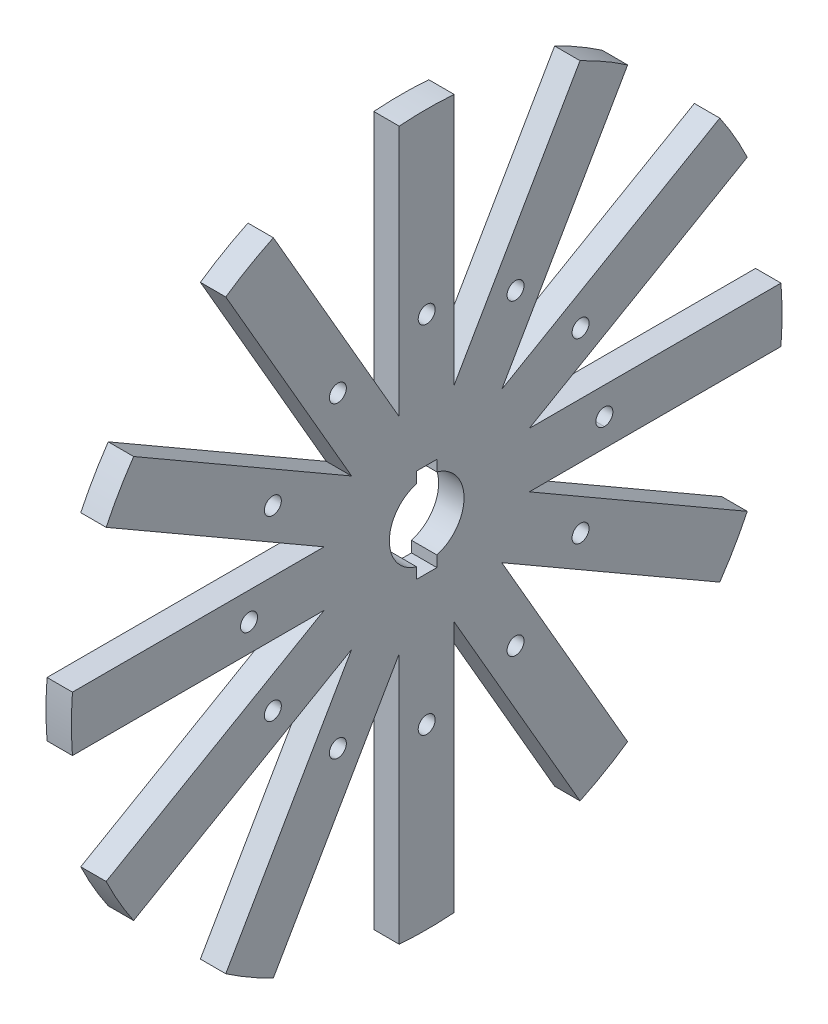
from build123d import *

# Parameters (mm, degrees)
SKETCH1_W           = 450
SKETCH1_H           = 450
BOSS_EXTRUDE1_DEPTH = 5
BOSS_EXTRUDE2_DEPTH = 7.48
BOSS_EXTRUDE3_DEPTH = 7.48
SKETCH6_W           = 450
SKETCH6_H           = 450
CUT_EXTRUDE1_DEPTH  = 5
SKETCH7_R           = 11
SKETCH7_R_2         = 2.5
CUT_EXTRUDE2_DEPTH  = 10
SKETCH8_R           = 209.3091
SKETCH8_R_2         = 104.5891
CUT_EXTRUDE3_DEPTH  = 10
BOSS_EXTRUDE4_DEPTH = 7.48
SKETCH11_R          = 2.5
CUT_EXTRUDE5_DEPTH  = 10


# Read off the part's stored shape, not the designer's step: Boss-Extrude2
with BuildPart() as part:
    # Sketch1 → Boss-Extrude1 (new body)
    with BuildSketch(Plane(origin=(0, 0, 0), x_dir=(0, 0, -1), z_dir=(1, 0, 0))):
        Rectangle(SKETCH1_W, SKETCH1_H)
    extrude(amount=BOSS_EXTRUDE1_DEPTH)

    # Boss-Extrude2 outline → Boss-Extrude2 (add)
    with BuildSketch(Plane(origin=(5, 0, 0), x_dir=(0, 0, -1), z_dir=(1, 0, 0))):
        with BuildLine():
            Line((-164.971757583, 8.09), (-209.152698388, 8.09))
            ThreePointArc((-209.152698388, 8.09), (-209.3091, 0), (-209.152698388, -8.09))
            Line((-209.152698388, -8.09), (-164.971757583, -8.09))
            ThreePointArc((-164.971757583, -8.09), (-116.792827049, -116.792827049), (-8.09, -164.971757583))
            Line((-8.09, -164.971757583), (-8.09, -209.152698388))
            ThreePointArc((-8.09, -209.152698388), (0, -209.3091), (8.09, -209.152698388))
            Line((8.09, -209.152698388), (8.09, -164.971757583))
            ThreePointArc((8.09, -164.971757583), (116.792827049, -116.792827049), (164.971757583, -8.09))
            Line((164.971757583, -8.09), (209.152698388, -8.09))
            ThreePointArc((209.152698388, -8.09), (209.3091, 0), (209.152698388, 8.09))
            Line((209.152698388, 8.09), (164.971757583, 8.09))
            ThreePointArc((164.971757583, 8.09), (116.792827049, 116.792827049), (8.09, 164.971757583))
            Line((8.09, 164.971757583), (8.09, 209.152698388))
            ThreePointArc((8.09, 209.152698388), (0, 209.3091), (-8.09, 209.152698388))
            Line((-8.09, 209.152698388), (-8.09, 164.971757583))
            ThreePointArc((-8.09, 164.971757583), (-116.792827049, 116.792827049), (-164.971757583, 8.09))
        make_face()
        with BuildLine():
            Line((148.770198629, 8.09), (104.538333308, 8.09))
            ThreePointArc((104.538333308, 8.09), (104.8509, 0), (104.538333308, -8.09))
            Line((104.538333308, -8.09), (148.770198629, -8.09))
            ThreePointArc((148.770198629, -8.09), (105.351839329, -105.351839329), (8.09, -148.770198629))
            Line((8.09, -148.770198629), (8.09, -104.538333308))
            ThreePointArc((8.09, -104.538333308), (0, -104.8509), (-8.09, -104.538333308))
            Line((-8.09, -104.538333308), (-8.09, -148.770198629))
            ThreePointArc((-8.09, -148.770198629), (-105.351839329, -105.351839329), (-148.770198629, -8.09))
            Line((-148.770198629, -8.09), (-104.538333308, -8.09))
            ThreePointArc((-104.538333308, -8.09), (-104.8509, 0), (-104.538333308, 8.09))
            Line((-104.538333308, 8.09), (-148.770198629, 8.09))
            ThreePointArc((-148.770198629, 8.09), (-105.351839329, 105.351839329), (-8.09, 148.770198629))
            Line((-8.09, 148.770198629), (-8.09, 104.538333308))
            ThreePointArc((-8.09, 104.538333308), (0, 104.8509), (8.09, 104.538333308))
            Line((8.09, 104.538333308), (8.09, 148.770198629))
            ThreePointArc((8.09, 148.770198629), (105.351839329, 105.351839329), (148.770198629, 8.09))
        make_face(mode=Mode.SUBTRACT)
    extrude(amount=BOSS_EXTRUDE2_DEPTH)

    # Sketch5 → Boss-Extrude3 (add)
    with BuildSketch(Plane(origin=(5, 0, 0), x_dir=(0, 0, -1), z_dir=(1, 0, 0))):
        with BuildLine():
            Line((-19.319547743, 8.09), (-104.275748565, 8.09))
            ThreePointArc((-104.275748565, 8.09), (-104.5891, 0), (-104.275748565, -8.09))
            Line((-104.275748565, -8.09), (-19.319547743, -8.09))
            ThreePointArc((-19.319547743, -8.09), (0, -20.945), (19.319547743, -8.09))
            Line((19.319547743, -8.09), (104.275748565, -8.09))
            ThreePointArc((104.275748565, -8.09), (104.5891, 0), (104.275748565, 8.09))
            Line((104.275748565, 8.09), (19.319547743, 8.09))
            ThreePointArc((19.319547743, 8.09), (0, 20.945), (-19.319547743, 8.09))
        make_face()
    extrude(amount=BOSS_EXTRUDE3_DEPTH)

    # Sketch6 → Cut-Extrude1 (cut)
    with BuildSketch(Plane.ZY):
        Rectangle(SKETCH6_W, SKETCH6_H)
    extrude(amount=-CUT_EXTRUDE1_DEPTH, mode=Mode.SUBTRACT)


with BuildPart() as cut_extrude1_piece_1:
    # of the separate pieces the step leaves, piece 1, a body of its own (cut_extrude1_pieces)
    add(part.part.solids().sort_by_distance((5, 209.152698388, 8.09))[0])


with BuildPart() as cut_extrude1_piece_2:
    # of the separate pieces the step leaves, piece 2, a body of its own (cut_extrude1_pieces)
    add(part.part.solids().sort_by_distance((5, 8.09, -104.275748565))[0])


with BuildPart() as cut_extrude2_tool:
    # Sketch7 → Cut-Extrude2 (new body)
    with BuildSketch(Plane(origin=(12.48, 0, 0), x_dir=(0, 0, -1), z_dir=(1, 0, 0))):
        Circle(SKETCH7_R)
        with Locations((-183.1891, 0)):
            Circle(SKETCH7_R_2)
        with Locations((-130.9659, 0)):
            Circle(SKETCH7_R_2)
        with Locations((0, -183.1891)):
            Circle(SKETCH7_R_2)
        with Locations((0, -130.9659)):
            Circle(SKETCH7_R_2)
        with Locations((183.1891, 0)):
            Circle(SKETCH7_R_2)
        with Locations((52.3, 0)):
            Circle(SKETCH7_R_2)
        with Locations((-52.295, 0)):
            Circle(SKETCH7_R_2)
        with Locations((0, 183.1891)):
            Circle(SKETCH7_R_2)
        with Locations((0, 130.9659)):
            Circle(SKETCH7_R_2)
        with BuildLine():
            Line((-3, 13.8), (-3, 10.583005244))
            ThreePointArc((-3, 10.583005244), (0, 11), (3, 10.583005244))
            Line((3, 10.583005244), (3, 13.8))
            Line((3, 13.8), (-3, 13.8))
        make_face()
        with BuildLine():
            ThreePointArc((3, -10.583005244), (0, -11), (-3, -10.583005244))
            Line((-3, -10.583005244), (-3, -13.8))
            Line((-3, -13.8), (3, -13.8))
            Line((3, -13.8), (3, -10.583005244))
        make_face()
        with Locations((130.9659, 0)):
            Circle(SKETCH7_R_2)
    extrude(amount=-CUT_EXTRUDE2_DEPTH)


with BuildPart() as cut_extrude1_piece_1_1:
    add(cut_extrude1_piece_1.part)

    # Cut-Extrude2: cut by cut_extrude2_tool
    add(cut_extrude2_tool.part, mode=Mode.SUBTRACT)

    # Sketch8 → Cut-Extrude3 (cut)
    with BuildSketch(Plane(origin=(12.48, 0, 0), x_dir=(0, 0, -1), z_dir=(1, 0, 0))):
        Circle(SKETCH8_R)
        Circle(SKETCH8_R_2, mode=Mode.SUBTRACT)
    extrude(amount=-CUT_EXTRUDE3_DEPTH, mode=Mode.SUBTRACT)


with BuildPart() as cut_extrude1_piece_2_1:
    add(cut_extrude1_piece_2.part)

    # Cut-Extrude2: cut by cut_extrude2_tool
    add(cut_extrude2_tool.part, mode=Mode.SUBTRACT)

    # Sketch9 → Boss-Extrude4 (add)
    with BuildSketch(Plane(origin=(12.48, 0, 0), x_dir=(0, 0, -1), z_dir=(1, 0, 0))):
        with BuildLine():
            Line((-94.350447256, 45.131728766), (-30.192291033, 8.09))
            Line((-30.192291033, 8.09), (-19.319547743, 8.09))
            ThreePointArc((-19.319547743, 8.09), (0, 20.945), (19.319547743, 8.09))
            Line((19.319547743, 8.09), (30.192291033, 8.09))
            Line((30.192291033, 8.09), (94.350447256, 45.131728766))
            ThreePointArc((94.350447256, 45.131728766), (90.576817559, 52.29455), (86.260447256, 59.144019799))
            Line((86.260447256, 59.144019799), (22.102291033, 22.102291033))
            Line((22.102291033, 22.102291033), (59.144019799, 86.260447256))
            ThreePointArc((59.144019799, 86.260447256), (52.29455, 90.576817559), (45.131728766, 94.350447256))
            Line((45.131728766, 94.350447256), (8.09, 30.192291033))
            Line((8.09, 30.192291033), (8.09, 104.275748565))
            ThreePointArc((8.09, 104.275748565), (0, 104.5891), (-8.09, 104.275748565))
            Line((-8.09, 104.275748565), (-8.09, 30.192291033))
            Line((-8.09, 30.192291033), (-45.131728766, 94.350447256))
            ThreePointArc((-45.131728766, 94.350447256), (-52.29455, 90.576817559), (-59.144019799, 86.260447256))
            Line((-59.144019799, 86.260447256), (-22.102291033, 22.102291033))
            Line((-22.102291033, 22.102291033), (-86.260447256, 59.144019799))
            ThreePointArc((-86.260447256, 59.144019799), (-90.576817559, 52.29455), (-94.350447256, 45.131728766))
        make_face()
        with BuildLine():
            ThreePointArc((19.319547743, -8.09), (0, -20.945), (-19.319547743, -8.09))
            Line((-19.319547743, -8.09), (-30.192291033, -8.09))
            Line((-30.192291033, -8.09), (-94.350447256, -45.131728766))
            ThreePointArc((-94.350447256, -45.131728766), (-90.576817559, -52.29455), (-86.260447256, -59.144019799))
            Line((-86.260447256, -59.144019799), (-22.102291033, -22.102291033))
            Line((-22.102291033, -22.102291033), (-59.144019799, -86.260447256))
            ThreePointArc((-59.144019799, -86.260447256), (-52.29455, -90.576817559), (-45.131728766, -94.350447256))
            Line((-45.131728766, -94.350447256), (-8.09, -30.192291033))
            Line((-8.09, -30.192291033), (-8.09, -104.275748565))
            ThreePointArc((-8.09, -104.275748565), (0, -104.5891), (8.09, -104.275748565))
            Line((8.09, -104.275748565), (8.09, -30.192291033))
            Line((8.09, -30.192291033), (45.131728766, -94.350447256))
            ThreePointArc((45.131728766, -94.350447256), (52.29455, -90.576817559), (59.144019799, -86.260447256))
            Line((59.144019799, -86.260447256), (22.102291033, -22.102291033))
            Line((22.102291033, -22.102291033), (86.260447256, -59.144019799))
            ThreePointArc((86.260447256, -59.144019799), (90.576817559, -52.29455), (94.350447256, -45.131728766))
            Line((94.350447256, -45.131728766), (30.192291033, -8.09))
            Line((30.192291033, -8.09), (19.319547743, -8.09))
        make_face()
    extrude(amount=-BOSS_EXTRUDE4_DEPTH)

    # Sketch11 → Cut-Extrude5 (cut)
    with BuildSketch(Plane(origin=(12.48, 0, 0), x_dir=(0, 0, -1), z_dir=(1, 0, 0))):
        with Locations((-52.295, 0)):
            Circle(SKETCH11_R)
        with Locations((-45.288798491, 26.1475)):
            Circle(SKETCH11_R)
        with Locations((-26.1475, 45.288798491)):
            Circle(SKETCH11_R)
        with Locations((0, 52.295)):
            Circle(SKETCH11_R)
        with Locations((26.1475, 45.288798491)):
            Circle(SKETCH11_R)
        with Locations((45.288798491, 26.1475)):
            Circle(SKETCH11_R)
        with Locations((52.295, 0)):
            Circle(SKETCH11_R)
        with Locations((45.288798491, -26.1475)):
            Circle(SKETCH11_R)
        with Locations((26.1475, -45.288798491)):
            Circle(SKETCH11_R)
        with Locations((0, -52.295)):
            Circle(SKETCH11_R)
        with Locations((-26.1475, -45.288798491)):
            Circle(SKETCH11_R)
        with Locations((-45.288798491, -26.1475)):
            Circle(SKETCH11_R)
    extrude(amount=-CUT_EXTRUDE5_DEPTH, mode=Mode.SUBTRACT)


solid = cut_extrude1_piece_2_1.part
